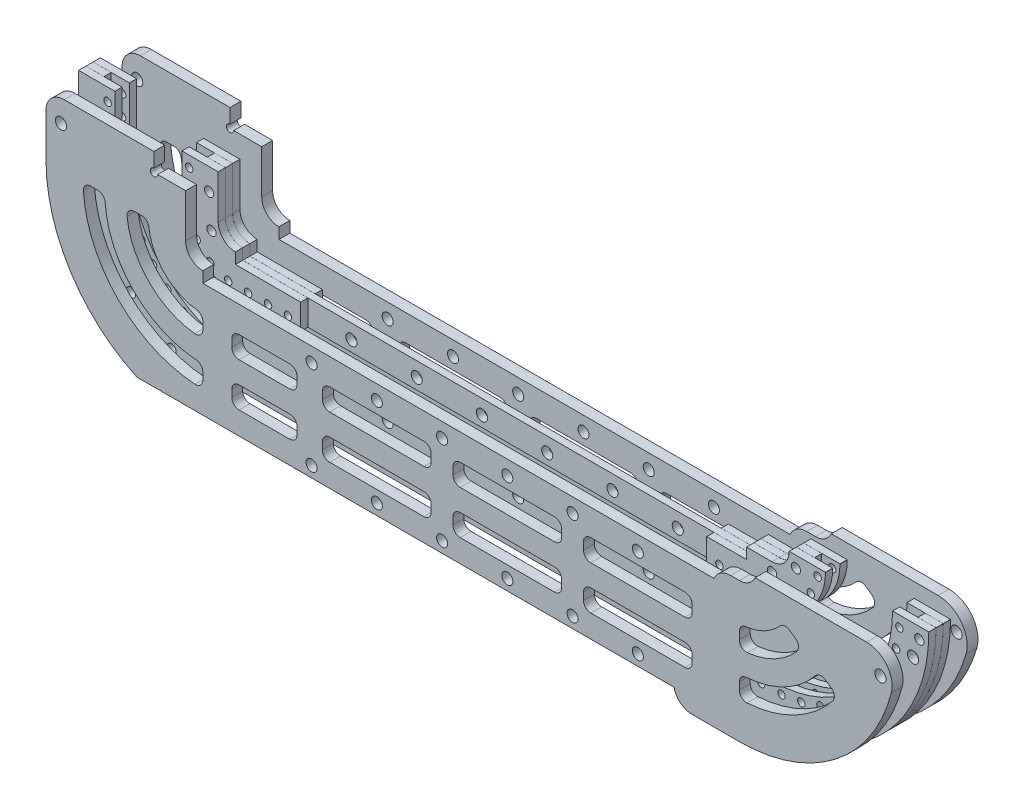
from build123d import *

# Parameters (mm, degrees)
SKETCH_1_R                 = 1.025
SKETCH_1_R_2               = 1.275
EXTRUDE_1_DEPTH            = 3
EXTRUDE_1_2_DEPTH          = 3
EXTRUDE_1_3_DEPTH          = 3
EXTRUDE_1_4_DEPTH          = 3
SKETCH_2_R                 = 1.275
SKETCH_2_R_2               = 1.525
EXTRUDE_2_DEPTH            = 1
CUT_EXTRUDE_4_DEPTH        = 0.995
EXTRUDE_START              = 9
EXTRUDE_3_DEPTH            = 3
EXTRUDE_START_2            = -9
EXTRUDE_4_DEPTH            = 3
CUT_EXTRUDE_5_DEPTH        = 126.547301843
CUT_EXTRUDE_5_DEPTH_BACK   = 126.547301843
SKETCH_6_R                 = 1.525
CUT_EXTRUDE_6_DEPTH        = 126.547301843
CUT_EXTRUDE_6_DEPTH_BACK   = 126.547301843
CUT_EXTRUDE_7_DEPTH        = 126.547301843
CUT_EXTRUDE_7_DEPTH_BACK   = 126.547301843
SKETCH_9_W                 = 141
SKETCH_9_H                 = 3
CUT_EXTRUDE_10_DEPTH       = 126.547301843
CUT_EXTRUDE_10_DEPTH_BACK  = 126.547301843
SKETCH_13_W                = 240.672430957
SKETCH_13_H                = 0.01
CUT_EXTRUDE_11_DEPTH       = 126.547301843
CUT_EXTRUDE_11_DEPTH_BACK  = 126.547301843
SKETCH_14_W                = 150
SKETCH_14_H                = 4
CUT_EXTRUDE_12_DEPTH       = 126.547301843
CUT_EXTRUDE_12_DEPTH_BACK  = 126.547301843
SKETCH_15_W                = 41.084707615
SKETCH_15_H                = 2
CUT_EXTRUDE_START          = -3
CUT_EXTRUDE_13_OUTLINE_W   = 18
CUT_EXTRUDE_13_OUTLINE_H   = 6
CUT_EXTRUDE_13_DEPTH       = 2
CUT_EXTRUDE_START_2        = 1
CUT_EXTRUDE_13_2_OUTLINE_W = 18
CUT_EXTRUDE_13_2_OUTLINE_H = 6
CUT_EXTRUDE_13_2_DEPTH     = 2
FILLET_1_R                 = 5
FILLET_2_R                 = 5
FILLET_3_R                 = 2
FILLET_4_R                 = 8
FILLET_5_R                 = 7
CUT_EXTRUDE_14_DEPTH       = 126.547301843
CUT_EXTRUDE_14_DEPTH_BACK  = 126.547301843
SKETCH_18_R                = 1.55
CUT_EXTRUDE_START_3        = -12
CUT_EXTRUDE_15_OUTLINE_W   = 30
CUT_EXTRUDE_15_OUTLINE_H   = 6
CUT_EXTRUDE_15_OUTLINE_W_2 = 18
CUT_EXTRUDE_15_DEPTH       = 24
FILLET_6_R                 = 2
FILLET_7_R                 = 2
CUT_EXTRUDE_16_DEPTH       = 126.547301843
CUT_EXTRUDE_16_DEPTH_BACK  = 126.547301843
SKETCH_20_R                = 1.55
FILLET_8_R                 = 3
FILLET_9_R                 = 3
FILLET_10_R                = 3


# Read off the part's stored shape, not the designer's step: 切除-拉伸13, 切除-拉伸15
with BuildPart() as part:
    # 草图1 → 凸台-拉伸1 (new, symmetric)
    with BuildSketch(Plane.XY):
        with BuildLine():
            Line((-117.25, 0), (-117.25, 17))
            Line((-117.25, 17), (-107.25, 17))
            Line((-107.25, 17), (-107.25, 0))
            ThreePointArc((-107.25, 0), (-97.511300474, -23.511300474), (-74, -33.25))
            Line((-74, -33.25), (-56, -33.25))
            Line((-56, -33.25), (-56, -43.25))
            Line((-56, -43.25), (-74, -43.25))
            ThreePointArc((-74, -43.25), (-104.582368286, -30.582368286), (-117.25, 0))
        make_face()
        with Locations((-109.130506686, -2.9)):
            Circle(SKETCH_1_R, mode=Mode.SUBTRACT)
        with Locations((-108.244331904, -8.359918208)):
            Circle(SKETCH_1_R, mode=Mode.SUBTRACT)
        with Locations((-106.514948021, -13.613987484)):
            Circle(SKETCH_1_R, mode=Mode.SUBTRACT)
        with Locations((-103.984938206, -18.532835207)):
            Circle(SKETCH_1_R, mode=Mode.SUBTRACT)
        with Locations((-100.716599698, -22.995343019)):
            Circle(SKETCH_1_R, mode=Mode.SUBTRACT)
        with Locations((-96.790409839, -26.891629169)):
            Circle(SKETCH_1_R, mode=Mode.SUBTRACT)
        with Locations((-92.303044452, -30.125754161)):
            Circle(SKETCH_1_R, mode=Mode.SUBTRACT)
        with Locations((-87.364997366, -32.618083104)):
            Circle(SKETCH_1_R, mode=Mode.SUBTRACT)
        with Locations((-82.09785969, -34.307246588)):
            Circle(SKETCH_1_R, mode=Mode.SUBTRACT)
        with Locations((-76.631325832, -35.151651801)):
            Circle(SKETCH_1_R, mode=Mode.SUBTRACT)
        with Locations((-109.25, 2.5)):
            Circle(SKETCH_1_R, mode=Mode.SUBTRACT)
        with Locations((-109.25, 8)):
            Circle(SKETCH_1_R, mode=Mode.SUBTRACT)
        with Locations((-109.25, 13.5)):
            Circle(SKETCH_1_R, mode=Mode.SUBTRACT)
        with Locations((-102.814601333, -28.814601333)):
            Circle(SKETCH_1_R_2, mode=Mode.SUBTRACT)
        with Locations((-91.631325832, -36.738247773)):
            Circle(SKETCH_1_R_2, mode=Mode.SUBTRACT)
        with Locations((-114.639420518, -3)):
            Circle(SKETCH_1_R_2, mode=Mode.SUBTRACT)
    extrude(amount=EXTRUDE_1_DEPTH, both=True)



with BuildPart() as body_2:
    # 草图1 → Extrude 1 2 (new, symmetric)
    with BuildSketch(Plane.XY):
        with BuildLine():
            Line((-88.75, 0), (-88.75, 12))
            Line((-88.75, 12), (-78.75, 12))
            Line((-78.75, 12), (-78.75, 0))
            ThreePointArc((-78.75, 0), (-77.358757211, -3.358757211), (-74, -4.75))
            Line((-74, -4.75), (-56, -4.75))
            Line((-56, -4.75), (-56, -14.75))
            Line((-56, -14.75), (-74, -14.75))
            ThreePointArc((-74, -14.75), (-84.429825023, -10.429825023), (-88.75, 0))
        make_face()
        with Locations((-86.592160259, -2)):
            Circle(SKETCH_1_R, mode=Mode.SUBTRACT)
        with Locations((-84.690037521, -6.948783908)):
            Circle(SKETCH_1_R, mode=Mode.SUBTRACT)
        with Locations((-80.939510179, -10.696059951)):
            Circle(SKETCH_1_R, mode=Mode.SUBTRACT)
        with Locations((-75.989078483, -12.593890058)):
            Circle(SKETCH_1_R, mode=Mode.SUBTRACT)
        with Locations((-86.75, 3.5)):
            Circle(SKETCH_1_R, mode=Mode.SUBTRACT)
        with Locations((-70.5, -12.75)):
            Circle(SKETCH_1_R, mode=Mode.SUBTRACT)
        with Locations((-86.75, 9)):
            Circle(SKETCH_1_R, mode=Mode.SUBTRACT)
        with Locations((-65, -12.75)):
            Circle(SKETCH_1_R, mode=Mode.SUBTRACT)
        with Locations((-59.5, -12.75)):
            Circle(SKETCH_1_R, mode=Mode.SUBTRACT)
        with Locations((-81.25, 6)):
            Circle(SKETCH_1_R_2, mode=Mode.SUBTRACT)
        with Locations((-80.600189391, -3)):
            Circle(SKETCH_1_R_2, mode=Mode.SUBTRACT)
    extrude(amount=EXTRUDE_1_2_DEPTH, both=True)


with BuildPart() as body_3:
    # 草图1 → Extrude 1 3 (new, symmetric)
    with BuildSketch(Plane.XY):
        with BuildLine():
            Line((56, -43.25), (74, -43.25))
            ThreePointArc((74, -43.25), (104.582368286, -30.582368286), (117.25, 0))
            Line((117.25, 0), (117.25, 0.1))
            Line((117.25, 0.1), (107.25, 0.1))
            Line((107.25, 0.1), (107.25, 0))
            ThreePointArc((107.25, 0), (97.511300474, -23.511300474), (74, -33.25))
            Line((74, -33.25), (56, -33.25))
            Line((56, -33.25), (56, -43.25))
        make_face()
        with Locations(Location((114.639420518, -3, 0), (0, 0, 180))):
            Circle(SKETCH_1_R_2, mode=Mode.SUBTRACT)
        with Locations(Location((91.631325832, -36.738247773, 0), (0, 0, 180))):
            Circle(SKETCH_1_R_2, mode=Mode.SUBTRACT)
        with Locations(Location((102.814601333, -28.814601333, 0), (0, 0, 180))):
            Circle(SKETCH_1_R_2, mode=Mode.SUBTRACT)
        with Locations(Location((60, -35.25, 0), (0, 0, 180))):
            Circle(SKETCH_1_R, mode=Mode.SUBTRACT)
        with Locations(Location((65.5, -35.25, 0), (0, 0, 180))):
            Circle(SKETCH_1_R, mode=Mode.SUBTRACT)
        with Locations(Location((71, -35.25, 0), (0, 0, 180))):
            Circle(SKETCH_1_R, mode=Mode.SUBTRACT)
        with Locations(Location((76.631325832, -35.151651801, 0), (0, 0, 180))):
            Circle(SKETCH_1_R, mode=Mode.SUBTRACT)
        with Locations(Location((82.09785969, -34.307246588, 0), (0, 0, 180))):
            Circle(SKETCH_1_R, mode=Mode.SUBTRACT)
        with Locations(Location((87.364997366, -32.618083104, 0), (0, 0, 180))):
            Circle(SKETCH_1_R, mode=Mode.SUBTRACT)
        with Locations(Location((92.303044452, -30.125754161, 0), (0, 0, 180))):
            Circle(SKETCH_1_R, mode=Mode.SUBTRACT)
        with Locations(Location((96.790409839, -26.891629169, 0), (0, 0, 180))):
            Circle(SKETCH_1_R, mode=Mode.SUBTRACT)
        with Locations(Location((100.716599698, -22.995343019, 0), (0, 0, 180))):
            Circle(SKETCH_1_R, mode=Mode.SUBTRACT)
        with Locations(Location((103.984938206, -18.532835207, 0), (0, 0, 180))):
            Circle(SKETCH_1_R, mode=Mode.SUBTRACT)
        with Locations(Location((106.514948021, -13.613987484, 0), (0, 0, 180))):
            Circle(SKETCH_1_R, mode=Mode.SUBTRACT)
        with Locations(Location((108.244331904, -8.359918208, 0), (0, 0, 180))):
            Circle(SKETCH_1_R, mode=Mode.SUBTRACT)
        with Locations(Location((109.130506686, -2.9, 0), (0, 0, 180))):
            Circle(SKETCH_1_R, mode=Mode.SUBTRACT)
        with Locations((63, -40.75)):
            Circle(SKETCH_1_R_2, mode=Mode.SUBTRACT)
    extrude(amount=EXTRUDE_1_3_DEPTH, both=True)


with BuildPart() as body_4:
    # 草图1 → Extrude 1 4 (new, symmetric)
    with BuildSketch(Plane.XY):
        with BuildLine():
            Line((56, -14.75), (74, -14.75))
            ThreePointArc((74, -14.75), (84.429825023, -10.429825023), (88.75, 0))
            Line((88.75, 0), (88.75, 0.1))
            Line((88.75, 0.1), (78.75, 0.1))
            Line((78.75, 0.1), (78.75, 0))
            ThreePointArc((78.75, 0), (77.358757211, -3.358757211), (74, -4.75))
            Line((74, -4.75), (56, -4.75))
            Line((56, -4.75), (56, -14.75))
        make_face()
        with Locations(Location((80.600189391, -3, 0), (0, 0, 180))):
            Circle(SKETCH_1_R_2, mode=Mode.SUBTRACT)
        with Locations(Location((59.5, -12.75, 0), (0, 0, 180))):
            Circle(SKETCH_1_R, mode=Mode.SUBTRACT)
        with Locations(Location((65, -12.75, 0), (0, 0, 180))):
            Circle(SKETCH_1_R, mode=Mode.SUBTRACT)
        with Locations(Location((70.5, -12.75, 0), (0, 0, 180))):
            Circle(SKETCH_1_R, mode=Mode.SUBTRACT)
        with Locations(Location((75.989078483, -12.593890058, 0), (0, 0, 180))):
            Circle(SKETCH_1_R, mode=Mode.SUBTRACT)
        with Locations(Location((80.939510179, -10.696059951, 0), (0, 0, 180))):
            Circle(SKETCH_1_R, mode=Mode.SUBTRACT)
        with Locations(Location((84.690037521, -6.948783908, 0), (0, 0, 180))):
            Circle(SKETCH_1_R, mode=Mode.SUBTRACT)
        with Locations(Location((86.592160259, -2, 0), (0, 0, 180))):
            Circle(SKETCH_1_R, mode=Mode.SUBTRACT)
        with Locations((74, -7.25)):
            Circle(SKETCH_1_R_2, mode=Mode.SUBTRACT)
    extrude(amount=EXTRUDE_1_4_DEPTH, both=True)


with BuildPart() as part_1:
    add(part.part)

    add(body_2.part)  # 凸台-拉伸2 merges body 2

    add(body_3.part)  # 凸台-拉伸2 merges body 3

    add(body_4.part)  # 凸台-拉伸2 merges body 4
    # 草图2 → 凸台-拉伸2 (add, symmetric)
    # profile 1 of 2: a face of its own
    with BuildSketch(Plane.XY):
        with BuildLine():
            Line((56, -4.75), (-56, -4.75))
            Line((-56, -4.75), (-74, -4.75))
            ThreePointArc((-74, -4.75), (-77.358757211, -3.358757211), (-78.75, 0))
            Line((-78.75, 0), (-78.75, 12))
            Line((-78.75, 12), (-88.75, 12))
            Line((-88.75, 12), (-88.75, 0))
            ThreePointArc((-88.75, 0), (-84.429825023, -10.429825023), (-74, -14.75))
            Line((-74, -14.75), (-56, -14.75))
            Line((-56, -14.75), (56, -14.75))
            Line((56, -14.75), (74, -14.75))
            ThreePointArc((74, -14.75), (84.429825023, -10.429825023), (88.75, 0))
            Line((88.75, 0), (88.75, 0.1))
            Line((88.75, 0.1), (78.75, 0.1))
            Line((78.75, 0.1), (78.75, 0))
            ThreePointArc((78.75, 0), (77.358757211, -3.358757211), (74, -4.75))
            Line((74, -4.75), (56, -4.75))
        make_face()
        with Locations((-81.25, 6)):
            Circle(SKETCH_2_R, mode=Mode.SUBTRACT)
        with Locations((-80.600189391, -3)):
            Circle(SKETCH_2_R, mode=Mode.SUBTRACT)
        with Locations(Location((80.600189391, -3, 0), (0, 0, 180))):
            Circle(SKETCH_2_R, mode=Mode.SUBTRACT)
        with Locations((46, -11.75)):
            Circle(SKETCH_2_R_2, mode=Mode.SUBTRACT)
        with Locations((28, -11.75)):
            Circle(SKETCH_2_R_2, mode=Mode.SUBTRACT)
        with Locations((10, -11.75)):
            Circle(SKETCH_2_R_2, mode=Mode.SUBTRACT)
        with Locations((-8, -11.75)):
            Circle(SKETCH_2_R_2, mode=Mode.SUBTRACT)
        with Locations((-26, -11.75)):
            Circle(SKETCH_2_R_2, mode=Mode.SUBTRACT)
        with Locations((-44, -11.75)):
            Circle(SKETCH_2_R_2, mode=Mode.SUBTRACT)
        with Locations((74, -7.25)):
            Circle(SKETCH_2_R, mode=Mode.SUBTRACT)
    # profile 2 of 2: a face of its own
    with BuildSketch(Plane.XY):
        with BuildLine():
            Line((-56, -33.25), (56, -33.25))
            Line((56, -33.25), (74, -33.25))
            ThreePointArc((74, -33.25), (97.511300474, -23.511300474), (107.25, 0))
            Line((107.25, 0), (107.25, 0.1))
            Line((107.25, 0.1), (117.25, 0.1))
            Line((117.25, 0.1), (117.25, 0))
            ThreePointArc((117.25, 0), (104.582368286, -30.582368286), (74, -43.25))
            Line((74, -43.25), (56, -43.25))
            Line((56, -43.25), (-56, -43.25))
            Line((-56, -43.25), (-74, -43.25))
            ThreePointArc((-74, -43.25), (-104.582368286, -30.582368286), (-117.25, 0))
            Line((-117.25, 0), (-117.25, 17))
            Line((-117.25, 17), (-107.25, 17))
            Line((-107.25, 17), (-107.25, 0))
            ThreePointArc((-107.25, 0), (-97.511300474, -23.511300474), (-74, -33.25))
            Line((-74, -33.25), (-56, -33.25))
        make_face()
        with Locations((-91.631325832, -36.738247773)):
            Circle(SKETCH_2_R, mode=Mode.SUBTRACT)
        with Locations((-102.814601333, -28.814601333)):
            Circle(SKETCH_2_R, mode=Mode.SUBTRACT)
        with Locations((-114.639420518, -3)):
            Circle(SKETCH_2_R, mode=Mode.SUBTRACT)
        with Locations(Location((114.639420518, -3, 0), (0, 0, 180))):
            Circle(SKETCH_2_R, mode=Mode.SUBTRACT)
        with Locations(Location((102.814601333, -28.814601333, 0), (0, 0, 180))):
            Circle(SKETCH_2_R, mode=Mode.SUBTRACT)
        with Locations(Location((91.631325832, -36.738247773, 0), (0, 0, 180))):
            Circle(SKETCH_2_R, mode=Mode.SUBTRACT)
        with Locations(Location((-44, -36.25, 0), (0, 0, 180))):
            Circle(SKETCH_2_R_2, mode=Mode.SUBTRACT)
        with Locations(Location((-26, -36.25, 0), (0, 0, 180))):
            Circle(SKETCH_2_R_2, mode=Mode.SUBTRACT)
        with Locations(Location((-8, -36.25, 0), (0, 0, 180))):
            Circle(SKETCH_2_R_2, mode=Mode.SUBTRACT)
        with Locations(Location((10, -36.25, 0), (0, 0, 180))):
            Circle(SKETCH_2_R_2, mode=Mode.SUBTRACT)
        with Locations(Location((28, -36.25, 0), (0, 0, 180))):
            Circle(SKETCH_2_R_2, mode=Mode.SUBTRACT)
        with Locations(Location((46, -36.25, 0), (0, 0, 180))):
            Circle(SKETCH_2_R_2, mode=Mode.SUBTRACT)
        with Locations((63, -40.75)):
            Circle(SKETCH_2_R, mode=Mode.SUBTRACT)
    extrude(amount=EXTRUDE_2_DEPTH, both=True)

    # 草图4 → 切除-拉伸4 (cut, symmetric)
    with BuildSketch(Plane.XY):
        with BuildLine():
            Line((-107.25, 0), (-107.25, 17))
            Line((-107.25, 17), (-112.25, 17))
            Line((-112.25, 17), (-112.25, 0))
            ThreePointArc((-112.25, 0), (-101.04683438, -27.04683438), (-74, -38.25))
            Line((-74, -38.25), (-74, -33.25))
            ThreePointArc((-74, -33.25), (-97.511300474, -23.511300474), (-107.25, 0))
        make_face()
        with BuildLine():
            Line((-88.75, 12), (-88.75, 0))
            ThreePointArc((-88.75, 0), (-84.429825023, -10.429825023), (-74, -14.75))
            Line((-74, -14.75), (-56, -14.75))
            Line((-56, -14.75), (-56, -9.75))
            Line((-56, -9.75), (-74, -9.75))
            ThreePointArc((-74, -9.75), (-80.894291117, -6.894291117), (-83.75, 0))
            Line((-83.75, 0), (-83.75, 12))
            Line((-83.75, 12), (-88.75, 12))
        make_face()
        with BuildLine():
            Line((74, -33.25), (56, -33.25))
            Line((56, -33.25), (56, -38.25))
            Line((56, -38.25), (74, -38.25))
            ThreePointArc((74, -38.25), (101.04683438, -27.04683438), (112.25, 0))
            Line((112.25, 0), (112.25, 0.1))
            Line((112.25, 0.1), (107.25, 0.1))
            Line((107.25, 0.1), (107.25, 0))
            ThreePointArc((107.25, 0), (97.511300474, -23.511300474), (74, -33.25))
        make_face()
        with BuildLine():
            Line((56, -14.75), (74, -14.75))
            ThreePointArc((74, -14.75), (84.429825023, -10.429825023), (88.75, 0))
            Line((88.75, 0), (88.75, 0.1))
            Line((88.75, 0.1), (83.75, 0.1))
            Line((83.75, 0.1), (83.75, 0))
            ThreePointArc((83.75, 0), (80.894291117, -6.894291117), (74, -9.75))
            Line((74, -9.75), (56, -9.75))
            Line((56, -9.75), (56, -14.75))
        make_face()
    extrude(amount=CUT_EXTRUDE_4_DEPTH, both=True, mode=Mode.SUBTRACT)


with BuildPart() as body_2_2:
    # 草图5 → 凸台-拉伸3 (new body)
    with BuildSketch(Plane.XY.offset(EXTRUDE_START)):
        with BuildLine():
            Line((117.25, 0.1), (78.75, 0.1))
            Line((78.75, 0.1), (78.75, 0))
            ThreePointArc((78.75, 0), (77.358757211, -3.358757211), (74, -4.75))
            Line((74, -4.75), (56, -4.75))
            Line((56, -4.75), (-56, -4.75))
            Line((-56, -4.75), (-74, -4.75))
            ThreePointArc((-74, -4.75), (-77.358757211, -3.358757211), (-78.75, 0))
            Line((-78.75, 0), (-78.75, 17))
            Line((-78.75, 17), (-117.25, 17))
            Line((-117.25, 17), (-117.25, 0))
            ThreePointArc((-117.25, 0), (-104.582368286, -30.582368286), (-74, -43.25))
            Line((-74, -43.25), (-56, -43.25))
            Line((-56, -43.25), (56, -43.25))
            Line((56, -43.25), (74, -43.25))
            ThreePointArc((74, -43.25), (104.582368286, -30.582368286), (117.25, 0))
            Line((117.25, 0), (117.25, 0.1))
        make_face()
    extrude(amount=EXTRUDE_3_DEPTH)


with BuildPart() as body_3_2:
    # 草图5<2> → 凸台-拉伸4 (new body)
    with BuildSketch(Plane.XY.offset(EXTRUDE_START_2)):
        with BuildLine():
            Line((117.25, 0.1), (78.75, 0.1))
            Line((78.75, 0.1), (78.75, 0))
            ThreePointArc((78.75, 0), (77.358757211, -3.358757211), (74, -4.75))
            Line((74, -4.75), (56, -4.75))
            Line((56, -4.75), (-56, -4.75))
            Line((-56, -4.75), (-74, -4.75))
            ThreePointArc((-74, -4.75), (-77.358757211, -3.358757211), (-78.75, 0))
            Line((-78.75, 0), (-78.75, 17))
            Line((-78.75, 17), (-117.25, 17))
            Line((-117.25, 17), (-117.25, 0))
            ThreePointArc((-117.25, 0), (-104.582368286, -30.582368286), (-74, -43.25))
            Line((-74, -43.25), (-56, -43.25))
            Line((-56, -43.25), (56, -43.25))
            Line((56, -43.25), (74, -43.25))
            ThreePointArc((74, -43.25), (104.582368286, -30.582368286), (117.25, 0))
            Line((117.25, 0), (117.25, 0.1))
        make_face()
    extrude(amount=-EXTRUDE_4_DEPTH)


with BuildPart() as cut_extrude_5_tool:
    # 草图6 → 切除-拉伸5 (new, two sides: drawn at the far end of the back side and taken through both)
    with BuildSketch(Plane.XY.offset(-CUT_EXTRUDE_5_DEPTH_BACK)):
        with Locations((46, -36.25)):
            Circle(SKETCH_6_R)
        with Locations((28, -36.25)):
            Circle(SKETCH_6_R)
        with Locations((10, -36.25)):
            Circle(SKETCH_6_R)
        with Locations((-8, -36.25)):
            Circle(SKETCH_6_R)
        with Locations((-26, -36.25)):
            Circle(SKETCH_6_R)
        with Locations((-44, -36.25)):
            Circle(SKETCH_6_R)
        with Locations((-44, -11.75)):
            Circle(SKETCH_6_R)
        with Locations((-26, -11.75)):
            Circle(SKETCH_6_R)
        with Locations((-8, -11.75)):
            Circle(SKETCH_6_R)
        with Locations((10, -11.75)):
            Circle(SKETCH_6_R)
        with Locations((28, -11.75)):
            Circle(SKETCH_6_R)
        with Locations((46, -11.75)):
            Circle(SKETCH_6_R)
    extrude(amount=CUT_EXTRUDE_5_DEPTH + CUT_EXTRUDE_5_DEPTH_BACK)


with BuildPart() as body_2_2_1:
    add(body_2_2.part)

    # 切除-拉伸5: cut by cut_extrude_5_tool
    add(cut_extrude_5_tool.part, mode=Mode.SUBTRACT)


with BuildPart() as body_3_2_1:
    add(body_3_2.part)

    # 切除-拉伸5: cut by cut_extrude_5_tool
    add(cut_extrude_5_tool.part, mode=Mode.SUBTRACT)


with BuildPart() as cut_extrude_6_tool:
    # 草图8 → 切除-拉伸6 (new, two sides: drawn at the far end of the back side and taken through both)
    with BuildSketch(Plane.XY.offset(-CUT_EXTRUDE_6_DEPTH_BACK)):
        with BuildLine():
            Line((-78.75, 17), (-87.5, 17))
            Line((-87.5, 17), (-87.5, 13))
            ThreePointArc((-87.5, 13), (-88.207106781, 11.292893219), (-86.5, 12))
            Line((-86.5, 12), (-78.75, 12))
            Line((-78.75, 12), (-78.75, 17))
        make_face()
    extrude(amount=CUT_EXTRUDE_6_DEPTH + CUT_EXTRUDE_6_DEPTH_BACK)


with BuildPart() as body_2_2_2:
    add(body_2_2_1.part)

    # 切除-拉伸6: cut by cut_extrude_6_tool
    add(cut_extrude_6_tool.part, mode=Mode.SUBTRACT)


with BuildPart() as body_3_2_2:
    add(body_3_2_1.part)

    # 切除-拉伸6: cut by cut_extrude_6_tool
    add(cut_extrude_6_tool.part, mode=Mode.SUBTRACT)


with BuildPart() as cut_extrude_7_tool:
    # 草图9 → 切除-拉伸7 (new, two sides: drawn at the far end of the back side and taken through both)
    with BuildSketch(Plane.XY.offset(-CUT_EXTRUDE_7_DEPTH_BACK)):
        with Locations((-3.5, -6.25)):
            Rectangle(SKETCH_9_W, SKETCH_9_H)
    extrude(amount=CUT_EXTRUDE_7_DEPTH + CUT_EXTRUDE_7_DEPTH_BACK)


with BuildPart() as part_2:
    add(part_1.part)

    # 切除-拉伸7: cut by cut_extrude_7_tool
    add(cut_extrude_7_tool.part, mode=Mode.SUBTRACT)

    # 草图13 → 切除-拉伸10 (cut, two sides: drawn at the far end of the back side and taken through both)
    with BuildSketch(Plane(origin=(0, 0, 0), x_dir=(1, 0, 0), z_dir=(0, 1, 0)).offset(-CUT_EXTRUDE_10_DEPTH_BACK)):
        with Locations((-2.530040732, 0.995)):
            Rectangle(SKETCH_13_W, SKETCH_13_H)
        with Locations((-2.530040732, -0.995)):
            Rectangle(SKETCH_13_W, SKETCH_13_H)
    extrude(amount=CUT_EXTRUDE_10_DEPTH + CUT_EXTRUDE_10_DEPTH_BACK, mode=Mode.SUBTRACT)


with BuildPart() as body_2_2_3:
    add(body_2_2_2.part)

    # 切除-拉伸7: cut by cut_extrude_7_tool
    add(cut_extrude_7_tool.part, mode=Mode.SUBTRACT)


with BuildPart() as body_3_2_3:
    add(body_3_2_2.part)

    # 切除-拉伸7: cut by cut_extrude_7_tool
    add(cut_extrude_7_tool.part, mode=Mode.SUBTRACT)


with BuildPart() as cut_extrude_11_tool:
    # 草图14 → 切除-拉伸11 (new, two sides: drawn at the far end of the back side and taken through both)
    with BuildSketch(Plane.XY.offset(-CUT_EXTRUDE_11_DEPTH_BACK)):
        with Locations((-19, -41.25)):
            Rectangle(SKETCH_14_W, SKETCH_14_H)
    extrude(amount=CUT_EXTRUDE_11_DEPTH + CUT_EXTRUDE_11_DEPTH_BACK)


with BuildPart() as part_3:
    add(part_2.part)

    # 切除-拉伸11: cut by cut_extrude_11_tool
    add(cut_extrude_11_tool.part, mode=Mode.SUBTRACT)

    # 切除-拉伸13 outline → 切除-拉伸13 (cut)
    with BuildSketch(Plane.XY.offset(CUT_EXTRUDE_START)):
        with Locations((-65, -36.25)):
            Rectangle(CUT_EXTRUDE_13_OUTLINE_W, CUT_EXTRUDE_13_OUTLINE_H)
    extrude(amount=CUT_EXTRUDE_13_DEPTH, mode=Mode.SUBTRACT)

    # Cut-Extrude 13 2 outline → Cut-Extrude 13 2 (cut)
    with BuildSketch(Plane.XY.offset(CUT_EXTRUDE_START_2)):
        with Locations((-65, -36.25)):
            Rectangle(CUT_EXTRUDE_13_2_OUTLINE_W, CUT_EXTRUDE_13_2_OUTLINE_H)
    extrude(amount=CUT_EXTRUDE_13_2_DEPTH, mode=Mode.SUBTRACT)

    # 圆角3
    fillet_3_edges = [part_3.edges().sort_by_distance(p)[0] for p in [
        (-74, -38.25, 0),
    ]]
    fillet(fillet_3_edges, radius=FILLET_3_R)


with BuildPart() as body_2_2_4:
    add(body_2_2_3.part)

    # 切除-拉伸11: cut by cut_extrude_11_tool
    add(cut_extrude_11_tool.part, mode=Mode.SUBTRACT)


with BuildPart() as body_3_2_4:
    add(body_3_2_3.part)

    # 切除-拉伸11: cut by cut_extrude_11_tool
    add(cut_extrude_11_tool.part, mode=Mode.SUBTRACT)


with BuildPart() as cut_extrude_12_tool:
    # 草图15 → 切除-拉伸12 (new, two sides: drawn at the far end of the back side and taken through both)
    with BuildSketch(Plane.XY.offset(-CUT_EXTRUDE_12_DEPTH_BACK)):
        with Locations((96.707646193, -0.9)):
            Rectangle(SKETCH_15_W, SKETCH_15_H)
    extrude(amount=CUT_EXTRUDE_12_DEPTH + CUT_EXTRUDE_12_DEPTH_BACK)


with BuildPart() as body_2_2_5:
    add(body_2_2_4.part)

    # 切除-拉伸12: cut by cut_extrude_12_tool
    add(cut_extrude_12_tool.part, mode=Mode.SUBTRACT)

    # 圆角1
    # the kernel refuses this fillet: 5 mm, written as the material it takes off along each edge
    with BuildSketch(Plane(origin=(67, -4.75, 23.456439237), x_dir=(0, -1, 0), z_dir=(0, 0, -1))) as fillet_1_piece_1:
        with BuildLine():
            CenterArc((5, -4.582575695), FILLET_1_R, 113.578178478, 66.421821522)
            Line((0, -4.582575695), (-0.1, -4.582575695))
            Line((-0.1, -4.582575695), (-0.1, 0))
            Line((-0.1, 0), (0, 0.1))
            ThreePointArc((0, 0.1), (1.5, 0.1), (2.96, 0.091651514))
            Line((2.96, 0.091651514), (3, 0))
        make_face()
    extrude(amount=25.912878475, mode=Mode.SUBTRACT)
    with BuildSketch(Plane(origin=(56, -43.25, -3.247448714), x_dir=(1, 0, 0), z_dir=(0, 0, 1))) as fillet_1_piece_2:
        with BuildLine():
            CenterArc((4.898979486, 5), FILLET_1_R, 191.536959033, 78.463040967)
            Line((0, 4), (-0.09797959, 3.98))
            ThreePointArc((-0.09797959, 3.98), (-0.1, 2), (-0.1, 0))
            Line((-0.1, 0), (0, -0.1))
            Line((0, -0.1), (4.898979486, -0.1))
            Line((4.898979486, -0.1), (4.898979486, 0))
        make_face()
    extrude(amount=27.494897428, mode=Mode.SUBTRACT)
    with BuildSketch(Plane(origin=(-117.25, 17, -3.5), x_dir=(0, -1, 0), z_dir=(0, 0, 1))) as fillet_1_piece_3:
        with BuildLine():
            CenterArc((FILLET_1_R, FILLET_1_R), FILLET_1_R, 180, 90)
            Line((0, FILLET_1_R), (-FILLET_1_R * 0.02, FILLET_1_R))
            Line((-FILLET_1_R * 0.02, FILLET_1_R), (-FILLET_1_R * 0.02, -FILLET_1_R * 0.02))
            Line((-FILLET_1_R * 0.02, -FILLET_1_R * 0.02), (FILLET_1_R, -FILLET_1_R * 0.02))
            Line((FILLET_1_R, -FILLET_1_R * 0.02), (FILLET_1_R, 0))
        make_face()
    extrude(amount=28, mode=Mode.SUBTRACT)

    # 圆角5
    fillet_5_edges = [body_2_2_5.edges().sort_by_distance(p)[0] for p in [
        (117.208245741, -1.9, 10.5),
    ]]
    fillet(fillet_5_edges, radius=FILLET_5_R)


with BuildPart() as body_3_2_5:
    add(body_3_2_4.part)

    # 切除-拉伸12: cut by cut_extrude_12_tool
    add(cut_extrude_12_tool.part, mode=Mode.SUBTRACT)

    # 圆角2
    # the kernel refuses this fillet: 5 mm, written as the material it takes off along each edge
    with BuildSketch(Plane(origin=(-117.25, 17, 3.5), x_dir=(0, -1, 0), z_dir=(0, 0, -1))) as fillet_2_piece_1:
        with BuildLine():
            CenterArc((FILLET_2_R, -FILLET_2_R), FILLET_2_R, 90, 90)
            Line((0, -FILLET_2_R), (-FILLET_2_R * 0.02, -FILLET_2_R))
            Line((-FILLET_2_R * 0.02, -FILLET_2_R), (-FILLET_2_R * 0.02, FILLET_2_R * 0.02))
            Line((-FILLET_2_R * 0.02, FILLET_2_R * 0.02), (FILLET_2_R, FILLET_2_R * 0.02))
            Line((FILLET_2_R, FILLET_2_R * 0.02), (FILLET_2_R, 0))
        make_face()
    extrude(amount=28, mode=Mode.SUBTRACT)
    with BuildSketch(Plane(origin=(67, -4.75, 2.456439237), x_dir=(0, -1, 0), z_dir=(0, 0, -1))) as fillet_2_piece_2:
        with BuildLine():
            CenterArc((5, -4.582575695), FILLET_2_R, 113.578178478, 66.421821522)
            Line((0, -4.582575695), (-0.1, -4.582575695))
            Line((-0.1, -4.582575695), (-0.1, 0))
            Line((-0.1, 0), (0, 0.1))
            ThreePointArc((0, 0.1), (1.5, 0.1), (2.96, 0.091651514))
            Line((2.96, 0.091651514), (3, 0))
        make_face()
    extrude(amount=25.912878475, mode=Mode.SUBTRACT)
    with BuildSketch(Plane(origin=(56, -43.25, -24.247448714), x_dir=(1, 0, 0), z_dir=(0, 0, 1))) as fillet_2_piece_3:
        with BuildLine():
            CenterArc((4.898979486, 5), FILLET_2_R, 191.536959033, 78.463040967)
            Line((0, 4), (-0.09797959, 3.98))
            ThreePointArc((-0.09797959, 3.98), (-0.1, 2), (-0.1, 0))
            Line((-0.1, 0), (0, -0.1))
            Line((0, -0.1), (4.898979486, -0.1))
            Line((4.898979486, -0.1), (4.898979486, 0))
        make_face()
    extrude(amount=27.494897428, mode=Mode.SUBTRACT)

    # 圆角4
    fillet_4_edges = [body_3_2_5.edges().sort_by_distance(p)[0] for p in [
        (117.208245741, -1.9, -10.5),
    ]]
    fillet(fillet_4_edges, radius=FILLET_4_R)


with BuildPart() as cut_extrude_14_tool:
    # 草图18 → 切除-拉伸14 (new, two sides: drawn at the far end of the back side and taken through both)
    with BuildSketch(Plane.XY.offset(-CUT_EXTRUDE_14_DEPTH_BACK)):
        with Locations((112.92, -8.1)):
            Circle(SKETCH_18_R)
    extrude(amount=CUT_EXTRUDE_14_DEPTH + CUT_EXTRUDE_14_DEPTH_BACK)


with BuildPart() as part_4:
    add(part_3.part)

    # 切除-拉伸14: cut by cut_extrude_14_tool
    add(cut_extrude_14_tool.part, mode=Mode.SUBTRACT)

    # 圆角8
    fillet_8_edges = [part_4.edges().sort_by_distance(p)[0] for p in [
        (56, -38.25, 0),
    ]]
    fillet(fillet_8_edges, radius=FILLET_8_R)

    # 圆角9
    fillet_9_edges = [part_4.edges().sort_by_distance(p)[0] for p in [
        (-56, -9.75, 0),
    ]]
    fillet(fillet_9_edges, radius=FILLET_9_R)

    # 圆角10
    fillet_10_edges = [part_4.edges().sort_by_distance(p)[0] for p in [
        (56, -9.75, 0),
    ]]
    fillet(fillet_10_edges, radius=FILLET_10_R)


with BuildPart() as body_2_2_6:
    add(body_2_2_5.part)

    # 切除-拉伸14: cut by cut_extrude_14_tool
    add(cut_extrude_14_tool.part, mode=Mode.SUBTRACT)


with BuildPart() as body_3_2_6:
    add(body_3_2_5.part)

    # 切除-拉伸14: cut by cut_extrude_14_tool
    add(cut_extrude_14_tool.part, mode=Mode.SUBTRACT)


with BuildPart() as cut_extrude_15_tool:
    # 切除-拉伸15 outline → 切除-拉伸15 (new body)
    with BuildSketch(Plane.XY.offset(CUT_EXTRUDE_START_3)):
        with BuildLine():
            ThreePointArc((-107, 0), (-97.334523779, -23.334523779), (-74, -33))
            Line((-74, -33), (-74, -27))
            ThreePointArc((-74, -27), (-93.091883092, -19.091883092), (-101, 0))
            Line((-101, 0), (-107, 0))
        make_face()
        with BuildLine():
            ThreePointArc((-95, 0), (-88.849242405, -14.849242405), (-74, -21))
            Line((-74, -21), (-74, -15))
            ThreePointArc((-74, -15), (-84.606601718, -10.606601718), (-89, 0))
            Line((-89, 0), (-95, 0))
        make_face()
        with Locations((46, -18)):
            Rectangle(CUT_EXTRUDE_15_OUTLINE_W, CUT_EXTRUDE_15_OUTLINE_H)
        with Locations((46, -30)):
            Rectangle(CUT_EXTRUDE_15_OUTLINE_W, CUT_EXTRUDE_15_OUTLINE_H)
        with Locations((10, -18)):
            Rectangle(CUT_EXTRUDE_15_OUTLINE_W, CUT_EXTRUDE_15_OUTLINE_H)
        with Locations((-26, -18)):
            Rectangle(CUT_EXTRUDE_15_OUTLINE_W, CUT_EXTRUDE_15_OUTLINE_H)
        with Locations((-57, -18)):
            Rectangle(CUT_EXTRUDE_15_OUTLINE_W_2, CUT_EXTRUDE_15_OUTLINE_H)
        with Locations((10, -30)):
            Rectangle(CUT_EXTRUDE_15_OUTLINE_W, CUT_EXTRUDE_15_OUTLINE_H)
        with Locations((-26, -30)):
            Rectangle(CUT_EXTRUDE_15_OUTLINE_W, CUT_EXTRUDE_15_OUTLINE_H)
        with Locations((-57, -30)):
            Rectangle(CUT_EXTRUDE_15_OUTLINE_W_2, CUT_EXTRUDE_15_OUTLINE_H)
        with BuildLine():
            Line((74, -27), (74, -33))
            ThreePointArc((74, -33), (89.237704237, -29.271357495), (101.032017462, -18.9280224))
            Line((101.032017462, -18.9280224), (96.117105196, -15.486563781))
            ThreePointArc((96.117105196, -15.486563781), (86.467212558, -23.949292496), (74, -27))
        make_face()
        with BuildLine():
            ThreePointArc((86.287280664, -8.603646545), (80.926229199, -13.305162498), (74, -15))
            Line((74, -15), (74, -21))
            ThreePointArc((74, -21), (83.696720878, -18.627227497), (91.20219293, -12.045105163))
            Line((91.20219293, -12.045105163), (86.287280664, -8.603646545))
        make_face()
    extrude(amount=CUT_EXTRUDE_15_DEPTH)


with BuildPart() as body_2_2_7:
    add(body_2_2_6.part)

    # 切除-拉伸15: cut by cut_extrude_15_tool
    add(cut_extrude_15_tool.part, mode=Mode.SUBTRACT)

    # 圆角6
    fillet_6_edges = [body_2_2_7.edges().sort_by_distance(p)[0] for p in [
        (-74, -21, 10.5),
        (-95, 0, 10.5),
        (-89, 0, 10.5),
        (-74, -15, 10.5),
        (-66, -15, 10.5),
        (-48, -15, 10.5),
        (-48, -21, 10.5),
        (-66, -21, 10.5),
        (-41, -21, 10.5),
        (-41, -15, 10.5),
        (-11, -15, 10.5),
        (-11, -21, 10.5),
        (74, -21, 10.5),
        (74, -15, 10.5),
        (86.287280664, -8.603646545, 10.5),
        (91.20219293, -12.045105163, 10.5),
        (101.032017462, -18.9280224, 10.5),
        (74, -33, 10.5),
        (74, -27, 10.5),
        (96.117105196, -15.486563781, 10.5),
        (-74, -27, 10.5),
        (-74, -33, 10.5),
        (-107, 0, 10.5),
        (-101, 0, 10.5),
        (-48, -27, 10.5),
        (-48, -33, 10.5),
        (-66, -33, 10.5),
        (-66, -27, 10.5),
        (-11, -33, 10.5),
        (-41, -33, 10.5),
        (-41, -27, 10.5),
        (-11, -27, 10.5),
        (-5, -21, 10.5),
        (-5, -15, 10.5),
        (25, -15, 10.5),
        (25, -21, 10.5),
        (25, -33, 10.5),
        (-5, -33, 10.5),
        (-5, -27, 10.5),
        (25, -27, 10.5),
        (61, -33, 10.5),
        (31, -33, 10.5),
        (31, -27, 10.5),
        (61, -27, 10.5),
        (31, -21, 10.5),
        (31, -15, 10.5),
        (61, -15, 10.5),
        (61, -21, 10.5),
    ]]
    fillet(fillet_6_edges, radius=FILLET_6_R)


with BuildPart() as body_3_2_7:
    add(body_3_2_6.part)

    # 切除-拉伸15: cut by cut_extrude_15_tool
    add(cut_extrude_15_tool.part, mode=Mode.SUBTRACT)

    # 圆角7
    fillet_7_edges = [body_3_2_7.edges().sort_by_distance(p)[0] for p in [
        (-74, -21, -10.5),
        (-95, 0, -10.5),
        (-89, 0, -10.5),
        (-74, -15, -10.5),
        (-66, -15, -10.5),
        (-48, -15, -10.5),
        (-48, -21, -10.5),
        (-66, -21, -10.5),
        (-41, -21, -10.5),
        (-41, -15, -10.5),
        (-11, -15, -10.5),
        (-11, -21, -10.5),
        (74, -21, -10.5),
        (74, -15, -10.5),
        (86.287280664, -8.603646545, -10.5),
        (91.20219293, -12.045105163, -10.5),
        (101.032017462, -18.9280224, -10.5),
        (74, -33, -10.5),
        (74, -27, -10.5),
        (96.117105196, -15.486563781, -10.5),
        (-74, -27, -10.5),
        (-74, -33, -10.5),
        (-107, 0, -10.5),
        (-101, 0, -10.5),
        (-48, -27, -10.5),
        (-48, -33, -10.5),
        (-66, -33, -10.5),
        (-66, -27, -10.5),
        (-11, -33, -10.5),
        (-41, -33, -10.5),
        (-41, -27, -10.5),
        (-11, -27, -10.5),
        (-5, -21, -10.5),
        (-5, -15, -10.5),
        (25, -15, -10.5),
        (25, -21, -10.5),
        (25, -33, -10.5),
        (-5, -33, -10.5),
        (-5, -27, -10.5),
        (25, -27, -10.5),
        (61, -33, -10.5),
        (31, -33, -10.5),
        (31, -27, -10.5),
        (61, -27, -10.5),
        (31, -21, -10.5),
        (31, -15, -10.5),
        (61, -15, -10.5),
        (61, -21, -10.5),
    ]]
    fillet(fillet_7_edges, radius=FILLET_7_R)


with BuildPart() as cut_extrude_16_tool:
    # 草图20 → 切除-拉伸16 (new, two sides: drawn at the far end of the back side and taken through both)
    with BuildSketch(Plane.XY.offset(-CUT_EXTRUDE_16_DEPTH_BACK)):
        with Locations((-113.1, 10.9)):
            Circle(SKETCH_20_R)
    extrude(amount=CUT_EXTRUDE_16_DEPTH + CUT_EXTRUDE_16_DEPTH_BACK)


with BuildPart() as body_2_2_8:
    add(body_2_2_7.part)

    # 切除-拉伸16: cut by cut_extrude_16_tool
    add(cut_extrude_16_tool.part, mode=Mode.SUBTRACT)


with BuildPart() as body_3_2_8:
    add(body_3_2_7.part)

    # 切除-拉伸16: cut by cut_extrude_16_tool
    add(cut_extrude_16_tool.part, mode=Mode.SUBTRACT)


solid = Compound([part_4.part, body_2_2_8.part, body_3_2_8.part])
